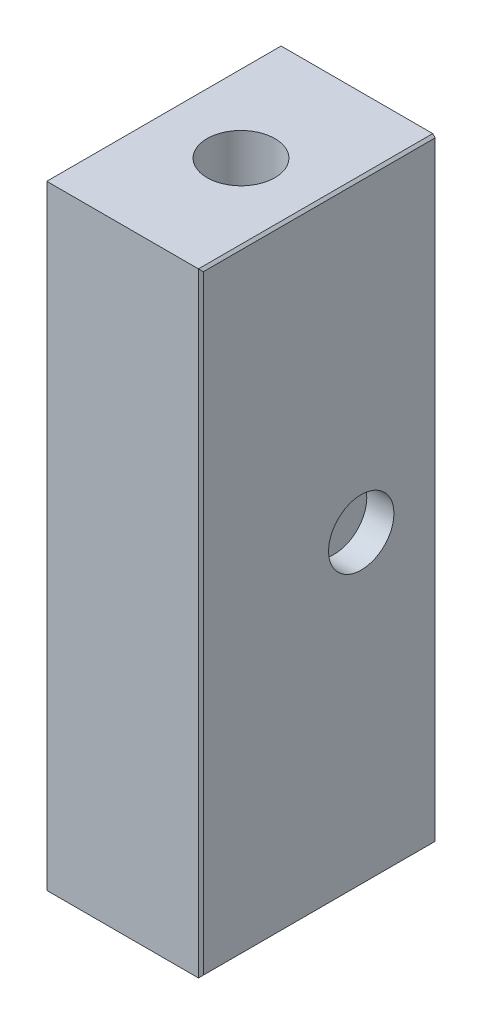
from build123d import *

# Parameters (mm, degrees)
SKETCH1_W           = 12.5
SKETCH1_H           = 19
SKETCH1_R           = 2.75
BOSS_EXTRUDE1_DEPTH = 24.9
SKETCH2_R           = 2.65
CUT_EXTRUDE1_DEPTH  = 2.2
CHAMFER1_SIZE       = 0.2


with BuildPart() as part:
    # Sketch1 → Boss-Extrude1 (new, symmetric)
    with BuildSketch(Plane(origin=(0, 0, 0), x_dir=(1, 0, 0), z_dir=(0, 1, 0))):
        Rectangle(SKETCH1_W, SKETCH1_H)
        Circle(SKETCH1_R, mode=Mode.SUBTRACT)
    extrude(amount=BOSS_EXTRUDE1_DEPTH, both=True)

    # Sketch2 → Cut-Extrude1 (cut)
    with BuildSketch(Plane(origin=(6.25, 0, 0), x_dir=(0, 0, -1), z_dir=(1, 0, 0))):
        with Locations((3.5, 0)):
            Circle(SKETCH2_R)
    extrude(amount=-CUT_EXTRUDE1_DEPTH, mode=Mode.SUBTRACT)

    # Chamfer1
    chamfer1_edges = [part.edges().sort_by_distance(p)[0] for p in [
        (6.25, -24.9, 0),
        (6.25, 0, 9.5),
        (6.25, 24.9, 0),
    ]]
    chamfer(chamfer1_edges, length=CHAMFER1_SIZE)


solid = part.part
